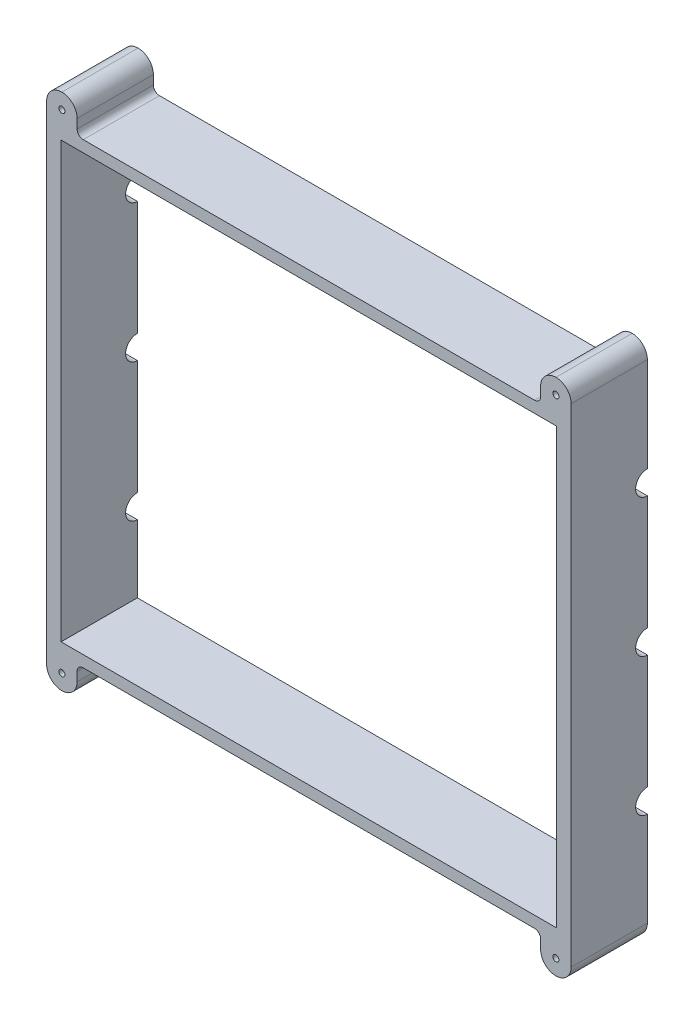
from build123d import *

# Parameters (mm, degrees)
SKETCH1_W            = 218.44
SKETCH1_H            = 190.5
BOSS_EXTRUDE1_DEPTH  = 31.75
SKETCH2_W            = 206.375
SKETCH2_H            = 180.975
CUT_EXTRUDE1_DEPTH   = 149.356440373
SKETCH3_R            = 4.8895
CUT_EXTRUDE2_DEPTH   = 241.409356307
SKETCH4_W            = 12.7
SKETCH4_H            = 12.7
BOSS_EXTRUDE2_DEPTH  = 31.75
SKETCH5_R            = 1.27
CUT_EXTRUDE3_DEPTH   = 157.81286108
FILLET1_R            = 6.35
SKETCH6_W            = 12.7
SKETCH6_H            = 12.7
SKETCH6_R            = 1.27
BOSS_EXTRUDE3_DEPTH  = 31.75
FILLET4_R            = 6.35
FILLET1_OF_MIRROR8_R = 6.35
FILLET4_OF_MIRROR8_R = 6.35
FILLET5_R            = 2.54


with BuildPart() as part:
    # Sketch1 → Boss-Extrude1 (new body)
    with BuildSketch(Plane.XY):
        Rectangle(SKETCH1_W, SKETCH1_H)
    extrude(amount=BOSS_EXTRUDE1_DEPTH)

    # Sketch2 → Cut-Extrude1 (cut, through all)
    with BuildSketch(Plane.XY.offset(31.75)):
        Rectangle(SKETCH2_W, SKETCH2_H)
    extrude(amount=-CUT_EXTRUDE1_DEPTH, mode=Mode.SUBTRACT)

    # Sketch3 → Cut-Extrude2 (cut, through all)
    with BuildSketch(Plane(origin=(109.22, 0, 0), x_dir=(0, 0, -1), z_dir=(1, 0, 0))):
        Circle(SKETCH3_R)
        with Locations((0, 57.404)):
            Circle(SKETCH3_R)
        with Locations((0, -57.404)):
            Circle(SKETCH3_R)
    extrude(amount=-CUT_EXTRUDE2_DEPTH, mode=Mode.SUBTRACT)

    # Sketch4 → Boss-Extrude2 (add, through all)
    with BuildSketch(Plane(origin=(0, 0, 0), x_dir=(-1, 0, 0), z_dir=(0, 0, -1))):
        with Locations((-102.87, 101.6)):
            Rectangle(SKETCH4_W, SKETCH4_H)
    boss_extrude2 = extrude(amount=-BOSS_EXTRUDE2_DEPTH)

    # Sketch5 → Cut-Extrude3 (cut, through all)
    with BuildSketch(Plane.XY.offset(31.75)):
        with Locations((102.87, 101.6)):
            Circle(SKETCH5_R)
    cut_extrude3 = extrude(amount=-CUT_EXTRUDE3_DEPTH, mode=Mode.SUBTRACT)

    # Fillet1
    fillet1_edges = [part.edges().sort_by_distance(p)[0] for p in [
        (96.52, 107.95, 15.875),
        (109.22, 107.95, 15.875),
    ]]
    fillet(fillet1_edges, radius=FILLET1_R - 0.0001)  # a hair under: the kernel refuses the full size

    # Sketch6 → Boss-Extrude3 (add, through all)
    with BuildSketch(Plane(origin=(0, 0, 0), x_dir=(-1, 0, 0), z_dir=(0, 0, -1))):
        with Locations((-102.87, -101.6)):
            Rectangle(SKETCH6_W, SKETCH6_H)
        with Locations((-102.87, -101.6)):
            Circle(SKETCH6_R, mode=Mode.SUBTRACT)
    boss_extrude3 = extrude(amount=-BOSS_EXTRUDE3_DEPTH)

    # Fillet4
    fillet4_edges = [part.edges().sort_by_distance(p)[0] for p in [
        (109.22, -107.95, 15.875),
        (96.52, -107.95, 15.875),
    ]]
    fillet(fillet4_edges, radius=FILLET4_R - 0.0001)  # a hair under: the kernel refuses the full size

    # Mirror8: Boss-Extrude2, Cut-Extrude3, Boss-Extrude3 across plane
    add(boss_extrude2.mirror(Plane(origin=(0, 0, 0), x_dir=(0, 0, 1), z_dir=(1, 0, 0))))
    add(cut_extrude3.mirror(Plane(origin=(0, 0, 0), x_dir=(0, 0, 1), z_dir=(1, 0, 0))), mode=Mode.SUBTRACT)
    add(boss_extrude3.mirror(Plane(origin=(0, 0, 0), x_dir=(0, 0, 1), z_dir=(1, 0, 0))))

    # Fillet1 of Mirror8
    fillet1_of_mirror8_edges = [part.edges().sort_by_distance(p)[0] for p in [
        (-96.52, 107.95, 15.875),
        (-109.22, 107.95, 15.875),
    ]]
    fillet(fillet1_of_mirror8_edges, radius=FILLET1_OF_MIRROR8_R - 0.0001)  # a hair under: the kernel refuses the full size

    # Fillet4 of Mirror8
    fillet4_of_mirror8_edges = [part.edges().sort_by_distance(p)[0] for p in [
        (-109.22, -107.95, 15.875),
        (-96.52, -107.95, 15.875),
    ]]
    fillet(fillet4_of_mirror8_edges, radius=FILLET4_OF_MIRROR8_R - 0.0001)  # a hair under: the kernel refuses the full size

    # Fillet5
    fillet5_edges = [part.edges().sort_by_distance(p)[0] for p in [
        (96.52, -95.25, 15.875),
        (-96.52, 95.25, 15.875),
        (-96.52, -95.25, 15.875),
        (96.52, 95.25, 15.875),
    ]]
    fillet(fillet5_edges, radius=FILLET5_R)


solid = part.part
